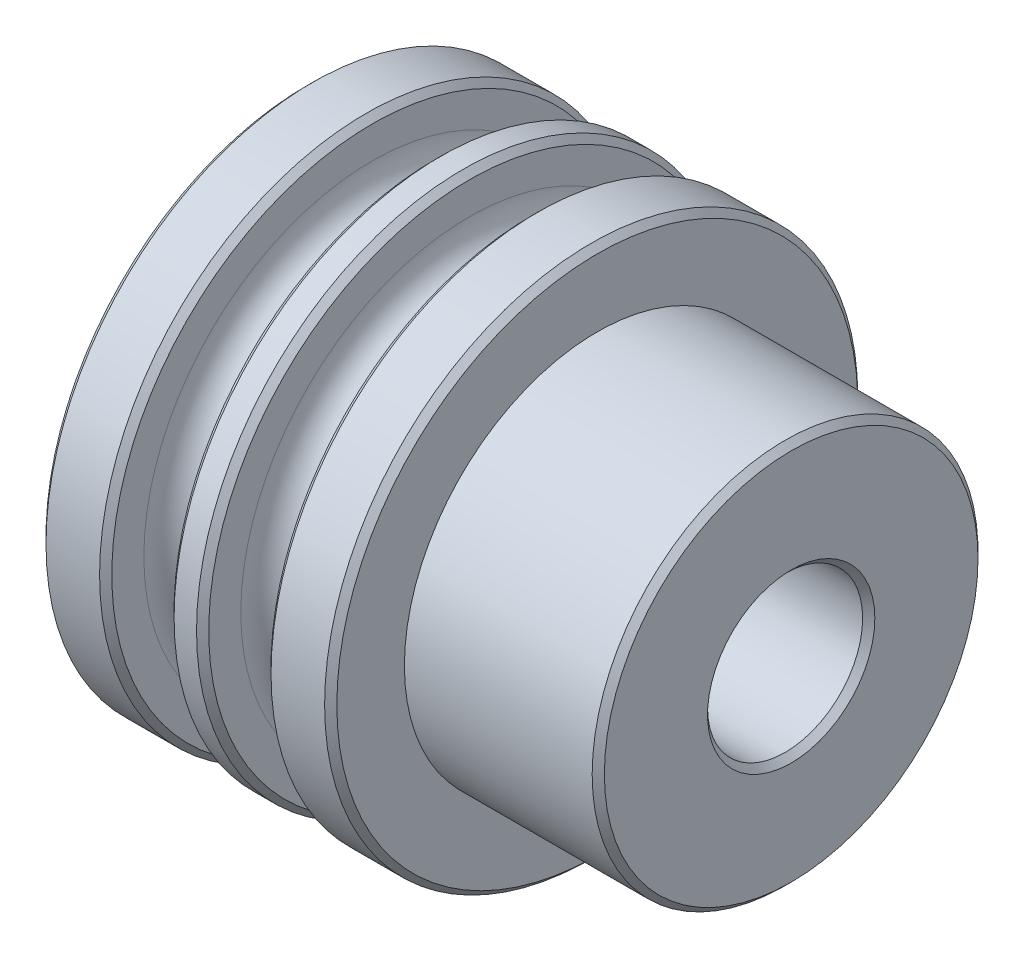
from build123d import *

# Parameters (mm, degrees)
SKETCH1_R           = 12.6365
BOSS_EXTRUDE1_DEPTH = 12.7
SKETCH2_R           = 17.4625
BOSS_EXTRUDE2_DEPTH = 19.05
SKETCH3_R           = 11.1125
CUT_EXTRUDE1_DEPTH  = 7.112
SKETCH4_R           = 7.27458794
CUT_EXTRUDE2_DEPTH  = 0.2
SKETCH5_R           = 5.08
CUT_EXTRUDE3_DEPTH  = 35.743253395
LPATTERN1_COUNT     = 2
LPATTERN1_PITCH     = 6.35
CHAMFER1_SIZE       = 0.4


with BuildPart() as part:
    # Sketch1 → Boss-Extrude1 (new body)
    with BuildSketch(Plane(origin=(0, 0, 0), x_dir=(0, 0, -1), z_dir=(1, 0, 0))):
        Circle(SKETCH1_R)
    extrude(amount=BOSS_EXTRUDE1_DEPTH)

    # Sketch2 → Boss-Extrude2 (add)
    with BuildSketch(Plane.ZY):
        Circle(SKETCH2_R)
    extrude(amount=BOSS_EXTRUDE2_DEPTH)

    # Sketch3 → Cut-Extrude1 (cut)
    with BuildSketch(Plane.ZY.offset(19.05)):
        Circle(SKETCH3_R)
    extrude(amount=-CUT_EXTRUDE1_DEPTH, mode=Mode.SUBTRACT)

    # Sketch4 → Cut-Extrude2 (cut)
    with BuildSketch(Plane.ZY.offset(11.938)):
        Circle(SKETCH4_R)
    extrude(amount=-CUT_EXTRUDE2_DEPTH, mode=Mode.SUBTRACT)

    # Sketch5 → Cut-Extrude3 (cut, through all)
    with BuildSketch(Plane.ZY.offset(11.738)):
        Circle(SKETCH5_R)
    extrude(amount=-CUT_EXTRUDE3_DEPTH, mode=Mode.SUBTRACT)

    # Sketch6 → Cut-Revolve1 (revolve, cut)
    with BuildSketch(Plane.XY):
        with BuildLine():
            Line((-4.310000016, 17.4625), (-8.389999984, 17.4625))
            Line((-8.389999984, 17.4625), (-8.389999984, 14.96249992))
            ThreePointArc((-8.389999984, 14.96249992), (-6.35, 12.922499936), (-4.310000016, 14.96249992))
            Line((-4.310000016, 14.96249992), (-4.310000016, 17.4625))
        make_face()
    cut_revolve1 = revolve(axis=Axis((-6.35, 0, 0), (1, 0, 0)), mode=Mode.SUBTRACT)

    # LPattern1: Cut-Revolve1 ×2
    with Locations(*[(-i * LPATTERN1_PITCH, 0, 0) for i in range(1, LPATTERN1_COUNT)]):
        add(cut_revolve1, mode=Mode.SUBTRACT)

    # Chamfer1
    chamfer1_edges = [part.edges().sort_by_distance(p)[0] for p in [
        (12.7, 0, 12.6365),
        (12.7, 0, -5.08),
        (-19.05, 0, -17.4625),
        (-19.05, 0, -11.1125),
        (-14.739999984, 0, -17.4625),
        (-8.389999984, 0, -17.4625),
        (-10.660000016, 0, -17.4625),
        (0, 0, -17.4625),
        (-4.310000016, 0, -17.4625),
    ]]
    chamfer(chamfer1_edges, length=CHAMFER1_SIZE)


solid = part.part
